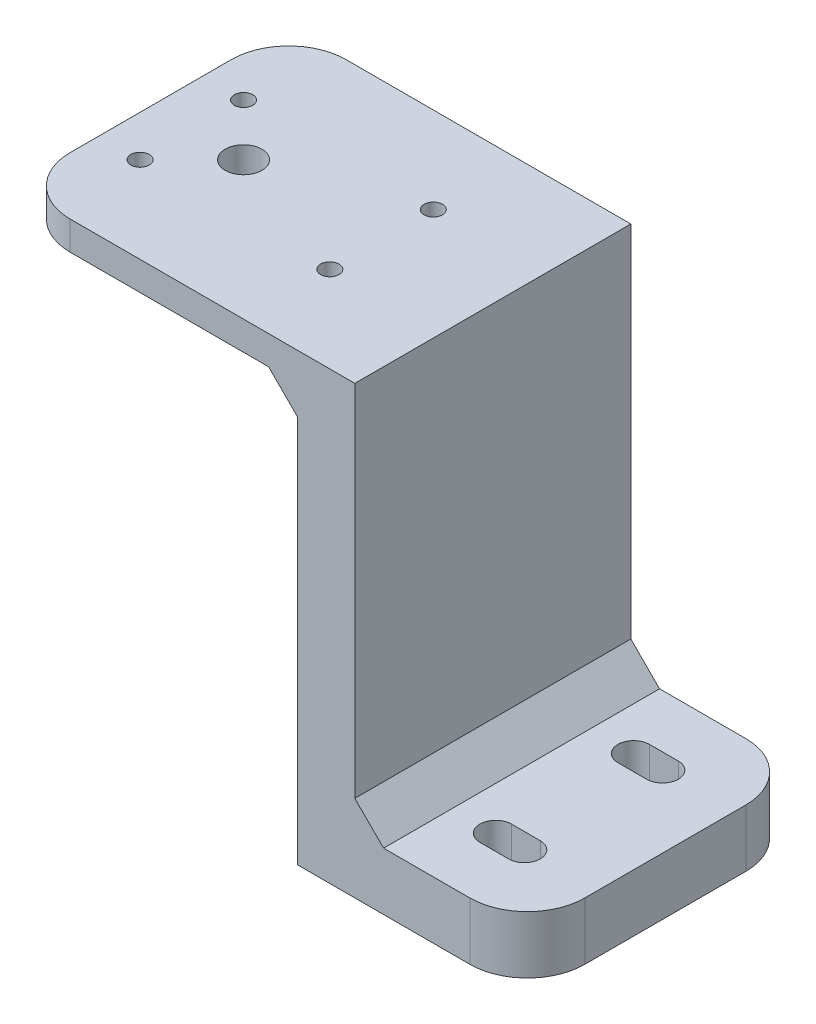
from build123d import *

# Parameters (mm, degrees)
SKETCH1_W                 = 59.5
SKETCH1_H                 = 48
BOSS_EXTRUDE1_DEPTH       = 5
SKETCH2_W                 = 10
SKETCH2_H                 = 48
BOSS_EXTRUDE2_DEPTH       = 72.5
SKETCH3_W                 = 48
SKETCH3_H                 = 10
BOSS_EXTRUDE3_DEPTH       = 30
FILLET1_R                 = 10
F_1_0MM_START             = -72.5
F_1_0MM_DOWEL_SLOT1_DEPTH = 10
FILLET2_R                 = 10
M3_CLEARANCE_HOLE1_D      = 3.2
M6_CLEARANCE_HOLE1_D      = 6.4
CHAMFER1_SIZE             = 5


# Read off the part's stored shape, not the designer's step: Ø1.0mm Dowel Slot1
with BuildPart() as part:
    # Sketch1 → Boss-Extrude1 (new body)
    with BuildSketch(Plane(origin=(0, 0, 0), x_dir=(1, 0, 0), z_dir=(0, 1, 0))):
        with Locations((5.75, 0)):
            Rectangle(SKETCH1_W, SKETCH1_H)
    extrude(amount=BOSS_EXTRUDE1_DEPTH)

    # Sketch2 → Boss-Extrude2 (add)
    with BuildSketch(Plane.XZ):
        with Locations((30.5, 0)):
            Rectangle(SKETCH2_W, SKETCH2_H)
    extrude(amount=BOSS_EXTRUDE2_DEPTH)

    # Sketch3 → Boss-Extrude3 (add)
    with BuildSketch(Plane(origin=(35.5, 0, 0), x_dir=(0, 0, -1), z_dir=(1, 0, 0))):
        with Locations((0, -67.5)):
            Rectangle(SKETCH3_W, SKETCH3_H)
    extrude(amount=BOSS_EXTRUDE3_DEPTH)

    # Fillet1
    fillet1_edges = [part.edges().sort_by_distance(p)[0] for p in [
        (-24, 2.5, -24),
        (-24, 2.5, 24),
    ]]
    fillet(fillet1_edges, radius=FILLET1_R)

    # Ø1.0mm Dowel Slot1 outline → Ø1.0mm Dowel Slot1 (cut)
    with BuildSketch(Plane(origin=(0, 0, 0), x_dir=(1, 0, 0), z_dir=(0, 1, 0)).offset(F_1_0MM_START)):
        with BuildLine():
            Line((53, 14.75), (48, 14.75))
            ThreePointArc((48, 14.75), (45.25, 12), (48, 9.25))
            Line((48, 9.25), (53, 9.25))
            ThreePointArc((53, 9.25), (55.75, 12), (53, 14.75))
        make_face()
        with BuildLine():
            Line((53, -9.25), (48, -9.25))
            ThreePointArc((48, -9.25), (45.25, -12), (48, -14.75))
            Line((48, -14.75), (53, -14.75))
            ThreePointArc((53, -14.75), (55.75, -12), (53, -9.25))
        make_face()
    extrude(amount=F_1_0MM_DOWEL_SLOT1_DEPTH, mode=Mode.SUBTRACT)

    # Fillet2
    fillet2_edges = [part.edges().sort_by_distance(p)[0] for p in [
        (65.5, -67.5, 24),
        (65.5, -67.5, -24),
    ]]
    fillet(fillet2_edges, radius=FILLET2_R)

    # M3 Clearance Hole1 (through all)
    with Locations(Plane(origin=(0, 5, 0), x_dir=(1, 0, 0), z_dir=(0, 1, 0))):
        with Locations((-16.85, -9), (-16.85, 9), (16.15, 9), (16.15, -9)):
            Hole(M3_CLEARANCE_HOLE1_D / 2)

    # M6 Clearance Hole1 (through all)
    with Locations(Plane(origin=(0, 5, 0), x_dir=(1, 0, 0), z_dir=(0, 1, 0))):
        with Locations((-7.85, 0)):
            Hole(M6_CLEARANCE_HOLE1_D / 2)

    # Chamfer1
    chamfer1_edges = [part.edges().sort_by_distance(p)[0] for p in [
        (25.5, 0, 0),
        (35.5, -62.5, 0),
    ]]
    chamfer(chamfer1_edges, length=CHAMFER1_SIZE)


solid = part.part
